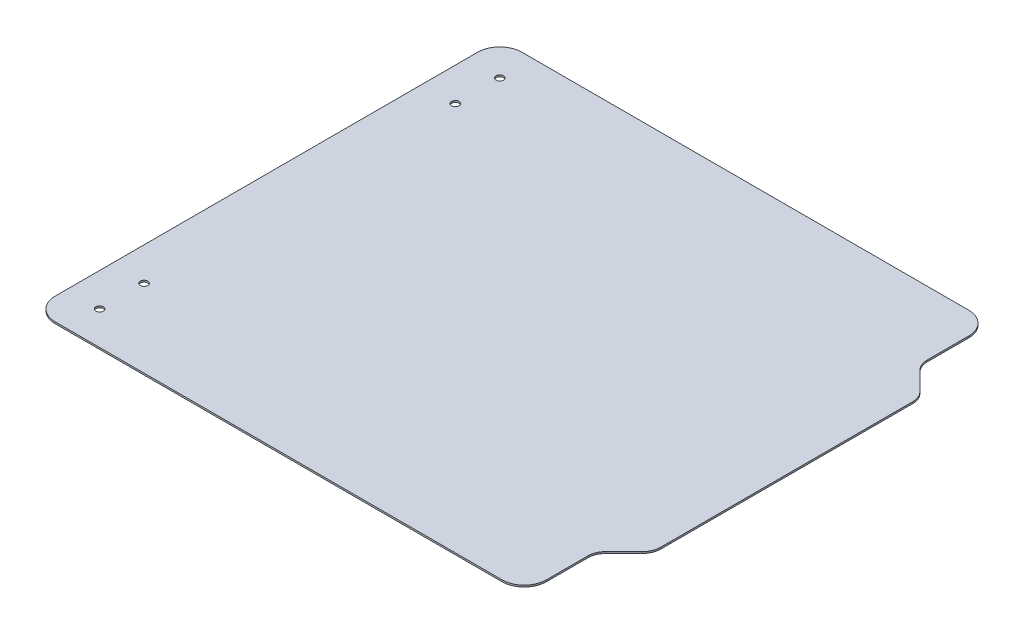
from build123d import *

# Parameters (mm, degrees)
SKETCH1_W           = 234
SKETCH1_H           = 210
BOSS_EXTRUDE1_DEPTH = 0.76
CUT_EXTRUDE1_DEPTH  = 0.76
FILLET1_R           = 8
FILLET2_R           = 10
SKETCH3_R           = 1.7
CUT_EXTRUDE2_DEPTH  = 158.208707138


with BuildPart() as part:
    # Sketch1 → Boss-Extrude1 (new body)
    with BuildSketch(Plane(origin=(0, 0, 0), x_dir=(1, 0, 0), z_dir=(0, 1, 0))):
        Rectangle(SKETCH1_W, SKETCH1_H)
    extrude(amount=BOSS_EXTRUDE1_DEPTH)

    # Sketch2 → Cut-Extrude1 (cut)
    with BuildSketch(Plane(origin=(0, 0.76, 0), x_dir=(1, 0, 0), z_dir=(0, 1, 0))):
        Polygon((117, 60), (104, 73), (104, 105), (117, 105), align=None)
        Polygon((104, -105), (117, -105), (117, -60), (104, -73), align=None)
    extrude(amount=-CUT_EXTRUDE1_DEPTH, mode=Mode.SUBTRACT)

    # Fillet1
    fillet1_edges = [part.edges().sort_by_distance(p)[0] for p in [
        (104, 0.38, 73),
        (117, 0.38, 60),
        (117, 0.38, -60),
        (104, 0.38, -73),
    ]]
    fillet(fillet1_edges, radius=FILLET1_R)

    # Fillet2
    fillet2_edges = [part.edges().sort_by_distance(p)[0] for p in [
        (-117, 0.38, -105),
        (-117, 0.38, 105),
        (104, 0.38, 105),
        (104, 0.38, -105),
    ]]
    fillet(fillet2_edges, radius=FILLET2_R)

    # Sketch3 → Cut-Extrude2 (cut, through all)
    with BuildSketch(Plane(origin=(0, 0.76, 0), x_dir=(1, 0, 0), z_dir=(0, 1, 0))):
        with Locations((-102, 70)):
            Circle(SKETCH3_R)
        with Locations((-102, 90)):
            Circle(SKETCH3_R)
        with Locations((-102, -90)):
            Circle(SKETCH3_R)
        with Locations((-102, -70)):
            Circle(SKETCH3_R)
    extrude(amount=-CUT_EXTRUDE2_DEPTH, mode=Mode.SUBTRACT)


solid = part.part
